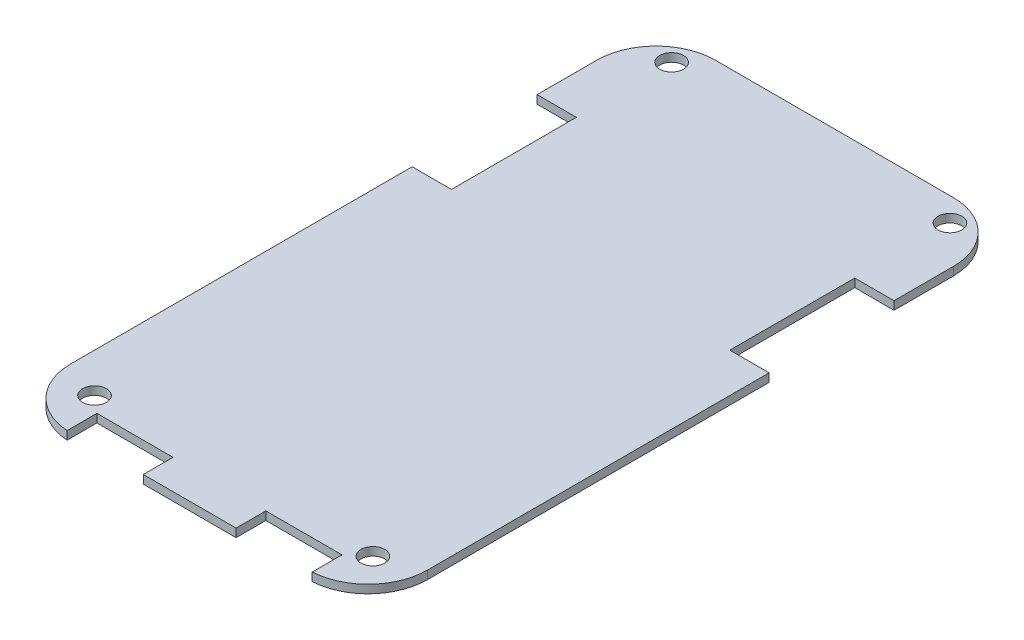
from build123d import *

# Parameters (mm, degrees)
SKETCH2_W          = 30
SKETCH2_H          = 54.2
CIRCUITBOARD_DEPTH = 0.7
SKETCH3_W          = 3.3
SKETCH3_H          = 10.5
SKETCH3_W_2        = 6.4
SKETCH3_H_2        = 2.5
CUT_EXTRUDE1_DEPTH = 31.982252985
FILLET2_R          = 5
SKETCH4_R          = 1
SCREWHOLES_DEPTH   = 31.982252985


with BuildPart() as part:
    # Sketch2 → CircuitBoard (new body)
    with BuildSketch(Plane(origin=(0, 0, 0), x_dir=(1, 0, 0), z_dir=(0, 1, 0))):
        Rectangle(SKETCH2_W, SKETCH2_H)
    extrude(amount=CIRCUITBOARD_DEPTH)

    # Sketch3 → Cut-Extrude1 (cut, through all)
    with BuildSketch(Plane(origin=(0, 0.7, 0), x_dir=(1, 0, 0), z_dir=(0, 1, 0))):
        with Locations((-13.35, 11.85)):
            Rectangle(SKETCH3_W, SKETCH3_H)
        with Locations((-7.1, -25.85)):
            Rectangle(SKETCH3_W_2, SKETCH3_H_2)
    cut_extrude1 = extrude(amount=-CUT_EXTRUDE1_DEPTH, mode=Mode.SUBTRACT)

    # Cut_Mirror: Cut-Extrude1 across plane
    add(cut_extrude1.mirror(Plane(origin=(0, 0, 0), x_dir=(0, 0, 1), z_dir=(1, 0, 0))), mode=Mode.SUBTRACT)

    # Cut_Mirror at the second plane: Cut-Extrude1 across plane
    add(cut_extrude1.mirror(Plane.ZX), mode=Mode.SUBTRACT)

    # Fillet2
    # the kernel refuses this fillet: 5 mm, written as the material it takes off along each edge
    with BuildSketch(Plane(origin=(-15, -12.477479713, 27.1), x_dir=(0, 0, -1), z_dir=(0, 1, 0))) as fillet2_piece_1:
        with BuildLine():
            CenterArc((4.990991885, -5), FILLET2_R, 90, 86.560187232)
            Line((0, -4.7), (-0.099819838, -4.694))
            ThreePointArc((-0.099819838, -4.694), (-0.1, -2.35), (-0.1, 0))
            Line((-0.1, 0), (0, 0.1))
            Line((0, 0.1), (4.990991885, 0.1))
            Line((4.990991885, 0.1), (4.990991885, 0))
        make_face()
    extrude(amount=25.654959427, mode=Mode.SUBTRACT)
    with BuildSketch(Plane(origin=(15, -12.477479713, 27.1), x_dir=(-1, 0, 0), z_dir=(0, 1, 0))) as fillet2_piece_2:
        with BuildLine():
            CenterArc((5, -4.990991885), FILLET2_R, 93.439812768, 86.560187232)
            Line((0, -4.990991885), (-0.1, -4.990991885))
            Line((-0.1, -4.990991885), (-0.1, 0))
            Line((-0.1, 0), (0, 0.1))
            ThreePointArc((0, 0.1), (2.35, 0.1), (4.694, 0.099819838))
            Line((4.694, 0.099819838), (4.7, 0))
        make_face()
    extrude(amount=25.654959427, mode=Mode.SUBTRACT)
    with BuildSketch(Plane(origin=(15, -12.5, -27.1), x_dir=(-1, 0, 0), z_dir=(0, 1, 0))) as fillet2_piece_3:
        with BuildLine():
            CenterArc((FILLET2_R, FILLET2_R), FILLET2_R, 180, 90)
            Line((0, FILLET2_R), (-FILLET2_R * 0.02, FILLET2_R))
            Line((-FILLET2_R * 0.02, FILLET2_R), (-FILLET2_R * 0.02, -FILLET2_R * 0.02))
            Line((-FILLET2_R * 0.02, -FILLET2_R * 0.02), (FILLET2_R, -FILLET2_R * 0.02))
            Line((FILLET2_R, -FILLET2_R * 0.02), (FILLET2_R, 0))
        make_face()
    extrude(amount=25.7, mode=Mode.SUBTRACT)
    with BuildSketch(Plane(origin=(-15, -12.5, -27.1), x_dir=(1, 0, 0), z_dir=(0, 1, 0))) as fillet2_piece_4:
        with BuildLine():
            CenterArc((FILLET2_R, -FILLET2_R), FILLET2_R, 90, 90)
            Line((0, -FILLET2_R), (-FILLET2_R * 0.02, -FILLET2_R))
            Line((-FILLET2_R * 0.02, -FILLET2_R), (-FILLET2_R * 0.02, FILLET2_R * 0.02))
            Line((-FILLET2_R * 0.02, FILLET2_R * 0.02), (FILLET2_R, FILLET2_R * 0.02))
            Line((FILLET2_R, FILLET2_R * 0.02), (FILLET2_R, 0))
        make_face()
    extrude(amount=25.7, mode=Mode.SUBTRACT)

    # Sketch4 → ScrewHoles (cut, through all)
    with BuildSketch(Plane(origin=(0, 0.7, 0), x_dir=(1, 0, 0), z_dir=(0, 1, 0))):
        with Locations(Location((-11.7, 25.1, 0), (0, 0, 270))):
            Circle(SKETCH4_R)
        with Locations(Location((-11.7, -23.4, 0), (0, 0, 270))):
            Circle(SKETCH4_R)
    screwholes = extrude(amount=-SCREWHOLES_DEPTH, mode=Mode.SUBTRACT)

    # ScrewHoles_Mirror: ScrewHoles across plane
    add(screwholes.mirror(Plane(origin=(0, 0, 0), x_dir=(0, 0, 1), z_dir=(1, 0, 0))), mode=Mode.SUBTRACT)

    # ScrewHoles_Mirror at the second plane: ScrewHoles across plane
    add(screwholes.mirror(Plane.ZX), mode=Mode.SUBTRACT)


solid = part.part
